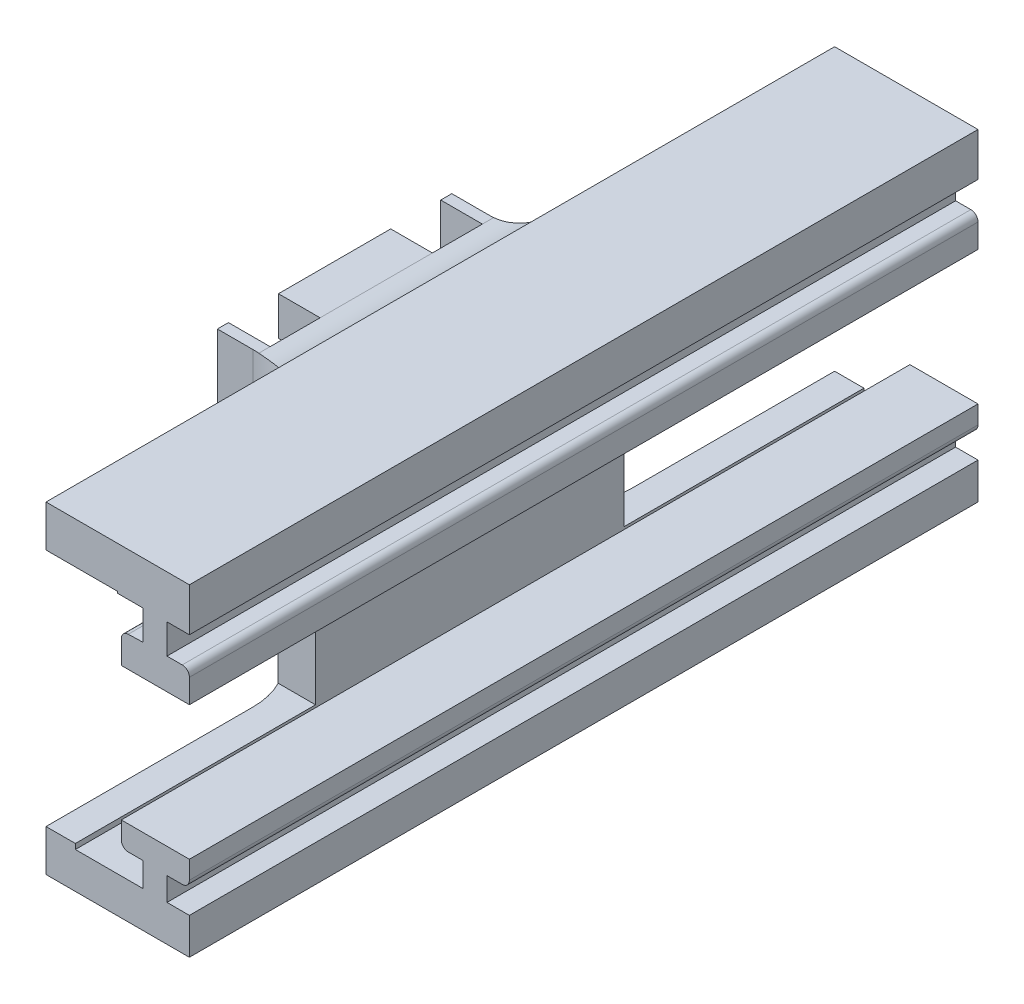
from build123d import *

# Parameters (mm, degrees)
BOSS_EXTRUDE1_DEPTH = 110
SKETCH2_W           = 33.5
SKETCH2_H           = 33.4
CUT_EXTRUDE1_DEPTH  = 10
SKETCH3_R           = 1.855174256
CUT_EXTRUDE3_DEPTH  = 10
SKETCH5_W           = 32.698767502
SKETCH5_H           = 33.097532959
BOSS_EXTRUDE2_DEPTH = 15
FILLET1_START       = 28.397979731
FILLET1_DEPTH       = 52.698767702
FILLET1_START_2     = -6.3183e-05
FILLET1_2_DEPTH     = 45.00011208
FILLET1_START_3     = 5.8
FILLET1_3_DEPTH     = 33.4
FILLET1_START_4     = 5.851542156
FILLET1_4_DEPTH     = 33.097532959
SKETCH6_R           = 13.931881445
CUT_EXTRUDE5_DEPTH  = 16
FILLET7_R           = 1
FILLET8_R           = 1
SKETCH8_W           = 6.973836054
SKETCH8_H           = 8.816669347
CUT_EXTRUDE6_DEPTH  = 9


with BuildPart() as part:
    # Sketch1 → Boss-Extrude1 (new body)
    with BuildSketch(Plane.XY):
        Polygon((0, 0), (0, 45), (20, 45), (20, 38.960548223), (16.876367343, 38.960548223), (16.876367343, 34.822386524), (20, 34.822386524), (20, 30.507676941), (10.5, 30.507676941), (10.5, 34.734112582), (13.516445061, 34.822386524), (13.516445061, 38.960548223), (10.5, 38.960548223), (4.092986166, 38.960548223), (4.092986166, 5.068373594), (10.5, 5.068373594), (13.538820233, 5.068373594), (13.538820233, 8.457591057), (10.5, 8.457591057), (10.5, 11.84680852), (20, 11.84680852), (20, 8.310671744), (16.876367343, 8.310671744), (16.876367343, 5.068373594), (20, 5.068373594), (20, 0), align=None)
    extrude(amount=BOSS_EXTRUDE1_DEPTH)

    # Sketch2 → Cut-Extrude1 (cut)
    with BuildSketch(Plane.ZY):
        with Locations((93.25, 22.5)):
            Rectangle(SKETCH2_W, SKETCH2_H)
        with Locations((16.75, 22.5)):
            Rectangle(SKETCH2_W, SKETCH2_H)
    extrude(amount=-CUT_EXTRUDE1_DEPTH, mode=Mode.SUBTRACT)

    # Sketch3 → Cut-Extrude3 (cut)
    with BuildSketch(Plane.ZY):
        with Locations((54.95102213, 22.327543377)):
            Circle(SKETCH3_R)
    extrude(amount=-CUT_EXTRUDE3_DEPTH, mode=Mode.SUBTRACT)

    # Sketch5 → Boss-Extrude2 (add)
    with BuildSketch(Plane.ZY):
        with Locations((54.747363582, 22.400308636)):
            Rectangle(SKETCH5_W, SKETCH5_H)
    extrude(amount=BOSS_EXTRUDE2_DEPTH)

    # Fillet1: read off the stored shape, not the designer's step
    # Fillet1 outline → Fillet1 (add)
    with BuildSketch(Plane.XY.offset(FILLET1_START)):
        with BuildLine():
            Line((0, 39.2), (2.35e-05, 45.000054671))
            ThreePointArc((2.35e-05, 45.000054671), (-3.686763576, 40.597721798), (-9.187208811, 38.949075115))
            Line((-9.187208811, 38.949075115), (0, 38.949075115))
            Line((0, 38.949075115), (0, 39.2))
        make_face()
        with BuildLine():
            Line((2.8807e-05, -6.3183e-05), (0, 5.851542156))
            Line((0, 5.851542156), (-9.098917382, 5.851542156))
            ThreePointArc((-9.098917382, 5.851542156), (-3.689848451, 4.262366926), (2.8807e-05, -6.3183e-05))
        make_face()
    extrude(amount=FILLET1_DEPTH)

    # Fillet1 2 outline → Fillet1 2 (cut)
    with BuildSketch(Plane(origin=(0, 0, 0), x_dir=(1, 0, 0), z_dir=(0, 1, 0)).offset(FILLET1_START_2)):
        with BuildLine():
            Line((-12, -28.397979731), (-12, -38.397979831))
            Line((-12, -38.397979831), (-10, -38.397979831))
            ThreePointArc((-10, -38.397979831), (-2.928932158, -35.469047613), (0, -28.397979745))
            Line((0, -28.397979745), (-12, -28.397979731))
        make_face()
        with BuildLine():
            Line((-10, -71.096747333), (-12, -71.096747333))
            Line((-12, -71.096747333), (-12, -81.096747433))
            Line((-12, -81.096747433), (0, -81.096747419))
            ThreePointArc((0, -81.096747419), (-2.928932158, -74.025679551), (-10, -71.096747333))
        make_face()
    extrude(amount=FILLET1_2_DEPTH, mode=Mode.SUBTRACT)

    # Fillet1 3 outline → Fillet1 3 (cut)
    with BuildSketch(Plane(origin=(0, 0, 0), x_dir=(1, 0, 0), z_dir=(0, 1, 0)).offset(FILLET1_START_3)):
        with BuildLine():
            Line((-1.399454076, -33.5), (0, -33.5))
            Line((0, -33.5), (0, -28.397979831))
            ThreePointArc((0, -28.397979831), (-0.356207716, -31.043215242), (-1.399454076, -33.5))
        make_face()
        with BuildLine():
            Line((0, -81.096747333), (0, -76.5))
            Line((0, -76.5), (-1.119126509, -76.5))
            ThreePointArc((-1.119126509, -76.5), (-0.283809005, -78.731238393), (0, -81.096747333))
        make_face()
    extrude(amount=FILLET1_3_DEPTH, mode=Mode.SUBTRACT)

    # Fillet1 4 outline → Fillet1 4 (add)
    with BuildSketch(Plane(origin=(0, 0, 0), x_dir=(1, 0, 0), z_dir=(0, 1, 0)).offset(FILLET1_START_4)):
        with BuildLine():
            Line((0, -38.397979831), (0, -33.5))
            Line((0, -33.5), (-1.399454076, -33.5))
            ThreePointArc((-1.399454076, -33.5), (-5.051272976, -37.087634649), (-10, -38.397979831))
            Line((-10, -38.397979831), (0, -38.397979831))
        make_face()
        with BuildLine():
            Line((-1.119126509, -76.5), (0, -76.5))
            Line((0, -76.5), (0, -71.096747333))
            Line((0, -71.096747333), (-10, -71.096747333))
            ThreePointArc((-10, -71.096747333), (-4.802282873, -72.55369538), (-1.119126509, -76.5))
        make_face()
    extrude(amount=FILLET1_4_DEPTH)

    # Sketch6 → Cut-Extrude5 (cut)
    with BuildSketch(Plane.ZY.offset(15)):
        with Locations((55, 21.872686564)):
            Circle(SKETCH6_R)
    extrude(amount=-CUT_EXTRUDE5_DEPTH, mode=Mode.SUBTRACT)

    # Fillet7
    fillet7_edges = [part.edges().sort_by_distance(p)[0] for p in [
        (20, 34.822386524, 55),
        (10.5, 34.734112582, 55),
    ]]
    fillet(fillet7_edges, radius=FILLET7_R)

    # Fillet8
    fillet8_edges = [part.edges().sort_by_distance(p)[0] for p in [
        (10.5, 8.457591057, 55),
        (20, 8.310671744, 55),
    ]]
    fillet(fillet8_edges, radius=FILLET8_R)

    # Sketch8 → Cut-Extrude6 (cut)
    with BuildSketch(Plane.ZY.offset(15)):
        with Locations((66.064245808, 34.540740441)):
            Rectangle(SKETCH8_W, SKETCH8_H)
        with Locations((43.430481356, 34.540740441)):
            Rectangle(SKETCH8_W, SKETCH8_H)
        with Locations((66.064245808, 10.25987683)):
            Rectangle(SKETCH8_W, SKETCH8_H)
        with Locations((43.430481356, 10.25987683)):
            Rectangle(SKETCH8_W, SKETCH8_H)
    extrude(amount=-CUT_EXTRUDE6_DEPTH, mode=Mode.SUBTRACT)


solid = part.part
